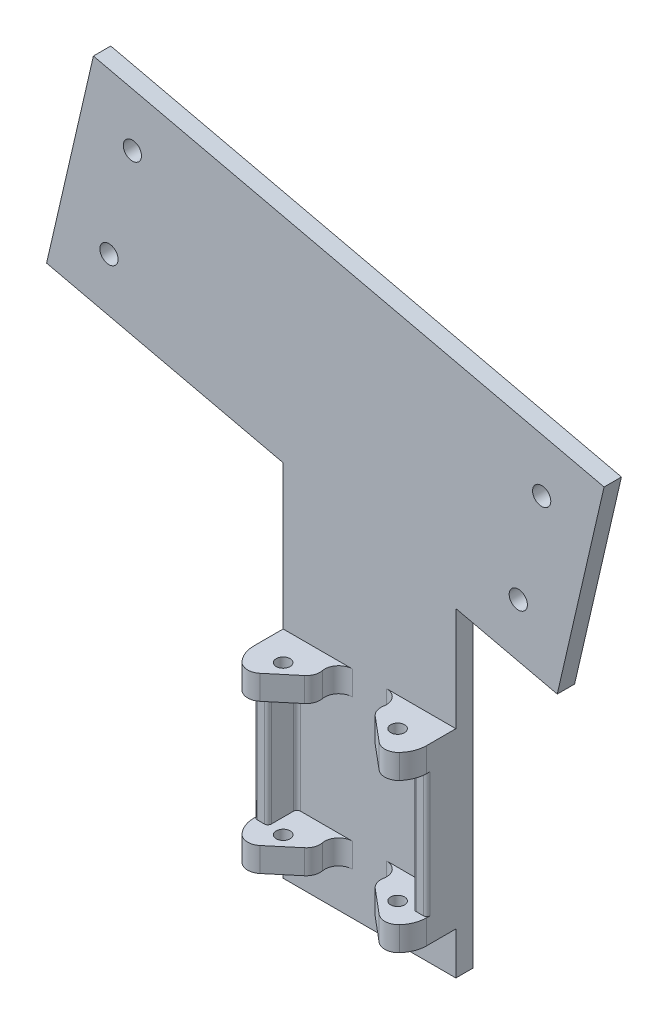
from build123d import *

# Parameters (mm, degrees)
BOSS_EXTRUDE2_DEPTH     = 7
CUT_EXTRUDE2_DEPTH      = 30.130224853
CUT_EXTRUDE2_DEPTH_BACK = 30.130224853
SKETCH3_R               = 2
BOSS_EXTRUDE3_DEPTH     = 36
SKETCH5_R               = 2
BOSS_EXTRUDE4_DEPTH     = 7
SKETCH14_W              = 49.8
SKETCH14_H              = 5
BOSS_EXTRUDE7_DEPTH     = 30
SKETCH16_W              = 49.8
SKETCH16_H              = 5
BOSS_EXTRUDE8_DEPTH     = 12.25
BOSS_EXTRUDE9_DEPTH     = 5
FILLET1_DEPTH           = 50
FILLET1_2_DEPTH         = 7
FILLET1_START           = 43
FILLET1_3_DEPTH         = 7
FILLET2_R               = 4
FILLET3_R               = 1
CUT_EXTRUDE3_DEPTH      = 191.690493415
CUT_EXTRUDE3_DEPTH_BACK = 191.690493415
SKETCH19_R              = 2.625


with BuildPart() as part:
    # Sketch1 → Boss-Extrude2 (new body)
    with BuildSketch(Plane(origin=(0, 0, 0), x_dir=(1, 0, 0), z_dir=(0, 1, 0))):
        with BuildLine():
            Line((-24.9, 0), (-24.9, 13.4))
            Line((-24.9, 13.4), (24.9, 13.4))
            Line((24.9, 13.4), (24.9, 0))
            ThreePointArc((24.9, 0), (23.392904185, -4.800819919), (19.412411454, -7.878950407))
            Line((19.412411454, -7.878950407), (8.235013612, 1.5))
            ThreePointArc((8.235013612, 1.5), (11.116692467, 6.448255578), (16.5, 8.4))
            Line((16.5, 8.4), (-16.5, 8.4))
            ThreePointArc((-16.5, 8.4), (-11.116692467, 6.448255578), (-8.235013612, 1.5))
            Line((-8.235013612, 1.5), (-19.412411454, -7.878950407))
            ThreePointArc((-19.412411454, -7.878950407), (-23.392904185, -4.800819919), (-24.9, 0))
        make_face()
    extrude(amount=BOSS_EXTRUDE2_DEPTH)

    # Sketch3 → Cut-Extrude2 (cut, two sides: drawn at the far end of the back side and taken through both)
    with BuildSketch(Plane(origin=(0, 7, 0), x_dir=(1, 0, 0), z_dir=(0, 1, 0)).offset(-CUT_EXTRUDE2_DEPTH_BACK)):
        with Locations(Location((-16.5, 0, 0), (0, 0, 270))):
            Circle(SKETCH3_R)
        with Locations(Location((16.5, 0, 0), (0, 0, 270))):
            Circle(SKETCH3_R)
    extrude(amount=CUT_EXTRUDE2_DEPTH + CUT_EXTRUDE2_DEPTH_BACK, mode=Mode.SUBTRACT)

    # Sketch4 → Boss-Extrude3 (add)
    with BuildSketch(Plane(origin=(0, 7, 0), x_dir=(1, 0, 0), z_dir=(0, 1, 0))):
        Polygon((-24.9, 13.4), (-24.9, 0), (-20.9, 0), (-20.9, 8.4), (-16.5, 8.4), (16.5, 8.4), (20.9, 8.4), (20.9, 0), (24.9, 0), (24.9, 13.4), align=None)
    extrude(amount=BOSS_EXTRUDE3_DEPTH)

    # Sketch5 → Boss-Extrude4 (add)
    with BuildSketch(Plane(origin=(0, 43, 0), x_dir=(1, 0, 0), z_dir=(0, 1, 0))):
        with BuildLine():
            Line((-24.9, 13.4), (-24.9, 0))
            ThreePointArc((-24.9, 0), (-23.392904185, -4.800819919), (-19.412411454, -7.878950407))
            Line((-19.412411454, -7.878950407), (-8.235013612, 1.5))
            ThreePointArc((-8.235013612, 1.5), (-11.116692467, 6.448255578), (-16.5, 8.4))
            Line((-16.5, 8.4), (16.5, 8.4))
            ThreePointArc((16.5, 8.4), (11.116692467, 6.448255578), (8.235013612, 1.5))
            Line((8.235013612, 1.5), (19.412411454, -7.878950407))
            ThreePointArc((19.412411454, -7.878950407), (23.392904185, -4.800819919), (24.9, 0))
            Line((24.9, 0), (24.9, 13.4))
            Line((24.9, 13.4), (-24.9, 13.4))
        make_face()
        with Locations(Location((16.5, 0, 0), (0, 0, 270))):
            Circle(SKETCH5_R, mode=Mode.SUBTRACT)
        with Locations(Location((-16.5, 0, 0), (0, 0, 270))):
            Circle(SKETCH5_R, mode=Mode.SUBTRACT)
    extrude(amount=BOSS_EXTRUDE4_DEPTH)

    # Sketch14 → Boss-Extrude7 (add)
    with BuildSketch(Plane(origin=(0, 50, 0), x_dir=(1, 0, 0), z_dir=(0, 1, 0))):
        with Locations((0, 10.9)):
            Rectangle(SKETCH14_W, SKETCH14_H)
    extrude(amount=BOSS_EXTRUDE7_DEPTH)

    # Sketch16 → Boss-Extrude8 (add)
    with BuildSketch(Plane.XZ):
        with Locations((0, -10.9)):
            Rectangle(SKETCH16_W, SKETCH16_H)
    extrude(amount=BOSS_EXTRUDE8_DEPTH)

    # Sketch17 → Boss-Extrude9 (add)
    with BuildSketch(Plane(origin=(0, 0, -13.4), x_dir=(-1, 0, 0), z_dir=(0, 0, -1))):
        Polygon((24.9, 80), (-24.9, 80), (-54.131101944, 73.25146837), (-67.628165204, 131.713672257), (79.608841274, 165.706013609), (93.105904535, 107.243809722), (24.9, 91.497235918), align=None)
    extrude(amount=-BOSS_EXTRUDE9_DEPTH)

    # Fillet1: read off the stored shape, not the designer's step
    # Fillet1 outline → Fillet1 (cut)
    with BuildSketch(Plane(origin=(0, 0, 0), x_dir=(1, 0, 0), z_dir=(0, 1, 0))):
        with BuildLine():
            Line((-19.412411454, -7.878950407), (-17.191978394, -6.015785846))
            ThreePointArc((-17.191978394, -6.015785846), (-20.037614317, -6.942179175), (-22.729609591, -5.63488814))
            ThreePointArc((-22.729609591, -5.63488814), (-21.206707029, -6.957507379), (-19.412411454, -7.878950407))
        make_face()
        with BuildLine():
            ThreePointArc((22.729609591, -5.63488814), (20.037614317, -6.942179175), (17.191978394, -6.015785846))
            Line((17.191978394, -6.015785846), (19.412411454, -7.878950407))
            ThreePointArc((19.412411454, -7.878950407), (21.206707029, -6.957507379), (22.729609591, -5.63488814))
        make_face()
    extrude(amount=FILLET1_DEPTH, mode=Mode.SUBTRACT)

    # Fillet1 2 outline → Fillet1 2 (add)
    with BuildSketch(Plane(origin=(0, 0, 0), x_dir=(1, 0, 0), z_dir=(0, 1, 0))):
        with BuildLine():
            Line((16.5, 8.4), (4.906898603, 8.4))
            ThreePointArc((4.906898603, 8.4), (8.19911817, 6.671847337), (8.646608731, 2.980645161))
            ThreePointArc((8.646608731, 2.980645161), (11.729120592, 6.91366109), (16.5, 8.4))
        make_face()
        with BuildLine():
            ThreePointArc((-16.5, 8.4), (-11.729120592, 6.91366109), (-8.646608731, 2.980645161))
            ThreePointArc((-8.646608731, 2.980645161), (-8.19911817, 6.671847337), (-4.906898603, 8.4))
            Line((-4.906898603, 8.4), (-16.5, 8.4))
        make_face()
    extrude(amount=FILLET1_2_DEPTH)

    # Fillet1 3 outline → Fillet1 3 (add)
    with BuildSketch(Plane(origin=(0, 0, 0), x_dir=(1, 0, 0), z_dir=(0, 1, 0)).offset(FILLET1_START)):
        with BuildLine():
            Line((16.5, 8.4), (4.906898603, 8.4))
            ThreePointArc((4.906898603, 8.4), (8.19911817, 6.671847337), (8.646608731, 2.980645161))
            ThreePointArc((8.646608731, 2.980645161), (11.729120592, 6.91366109), (16.5, 8.4))
        make_face()
        with BuildLine():
            ThreePointArc((-16.5, 8.4), (-11.729120592, 6.91366109), (-8.646608731, 2.980645161))
            ThreePointArc((-8.646608731, 2.980645161), (-8.19911817, 6.671847337), (-4.906898603, 8.4))
            Line((-4.906898603, 8.4), (-16.5, 8.4))
        make_face()
    extrude(amount=FILLET1_3_DEPTH)

    # Fillet2
    fillet2_edges = [part.edges().sort_by_distance(p)[0] for p in [
        (8.235013612, 46.5, -1.5),
        (-8.235013612, 46.5, -1.5),
        (8.235013612, 3.5, -1.5),
        (-8.235013612, 3.5, -1.5),
    ]]
    fillet(fillet2_edges, radius=FILLET2_R)

    # Fillet3
    fillet3_edges = [part.edges().sort_by_distance(p)[0] for p in [
        (-24.9, 25, 0),
        (-20.9, 25, 0),
        (-20.9, 25, -8.4),
        (20.9, 25, -8.4),
        (20.9, 25, 0),
        (24.9, 25, 0),
    ]]
    fillet(fillet3_edges, radius=FILLET3_R)

    # Sketch19 → Cut-Extrude3 (cut, two sides: drawn at the far end of the back side and taken through both)
    with BuildSketch(Plane.XY.offset(-8.4).offset(-CUT_EXTRUDE3_DEPTH_BACK)):
        with Locations((-75.116087748, 118.485094879)):
            Circle(SKETCH19_R)
        with Locations((42.889816787, 91.241285157)):
            Circle(SKETCH19_R)
        with Locations(Location((49.638348417, 120.4723871, 0), (0, 0, 180))):
            Circle(SKETCH19_R)
        with Locations(Location((-68.367556118, 147.716196822, 0), (0, 0, 180))):
            Circle(SKETCH19_R)
    extrude(amount=CUT_EXTRUDE3_DEPTH + CUT_EXTRUDE3_DEPTH_BACK, mode=Mode.SUBTRACT)


solid = part.part
